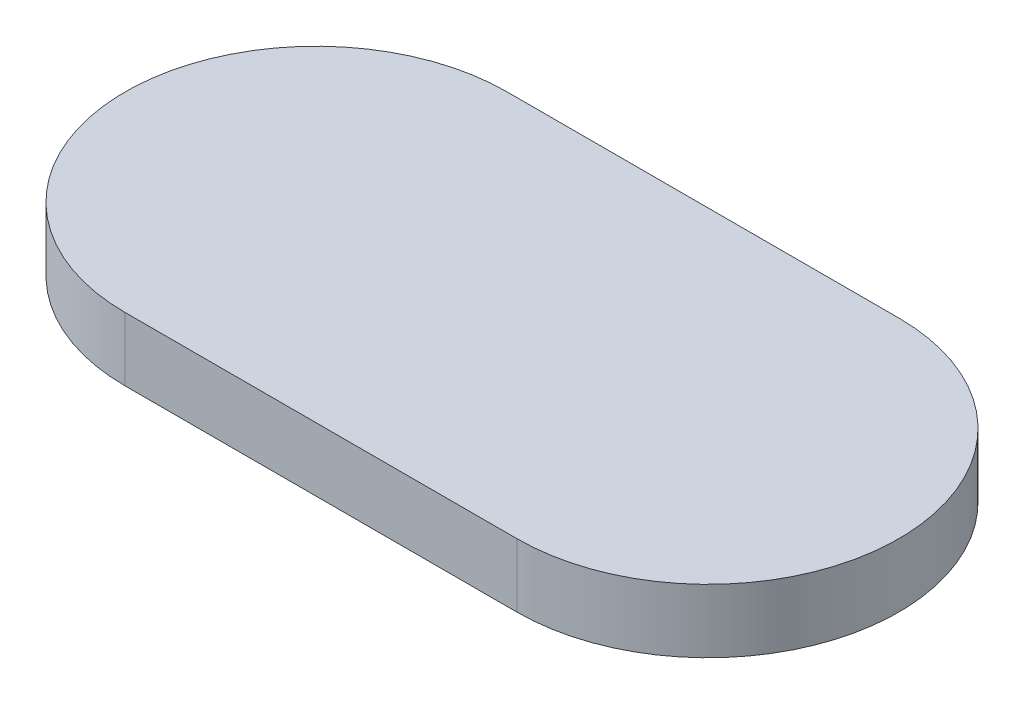
from build123d import *

# Parameters (mm, degrees)
DODANIE_WYCI_GNI_CIE1_DEPTH = 10


with BuildPart() as part:
    # Szkic1 → Dodanie-wyciągnięcie1 (new body)
    with BuildSketch(Plane(origin=(0, 0, 0), x_dir=(1, 0, 0), z_dir=(0, 1, 0))):
        with BuildLine():
            Line((0, 30.032086689), (61.604280389, 30.032086689))
            ThreePointArc((61.604280389, 30.032086689), (91.636367078, 0), (61.604280389, -30.032086689))
            Line((61.604280389, -30.032086689), (0, -30.032086689))
            ThreePointArc((0, -30.032086689), (-30.032086689, 0), (0, 30.032086689))
        make_face()
    extrude(amount=DODANIE_WYCI_GNI_CIE1_DEPTH)


solid = part.part
